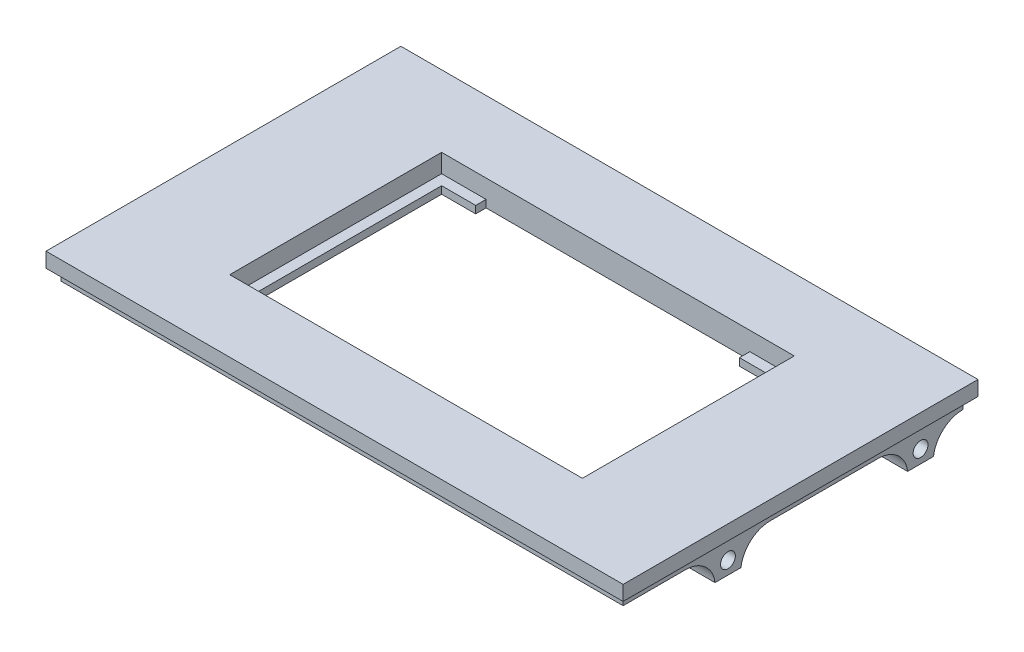
from build123d import *

# Parameters (mm, degrees)
SKETCH_1_W             = 77.9
SKETCH_1_H             = 47.9
EXTRUDE_1_DEPTH        = 2
SKETCH_2_W             = 47.6
SKETCH_2_H             = 28.6
CUT_EXTRUDE_1_DEPTH    = 27
SKETCH_4_W             = 75.9
SKETCH_4_H             = 45.9
SKETCH_4_W_2           = 47.6
SKETCH_4_H_2           = 28.6
EXTRUDE_3_DEPTH        = 0.5
SKETCH_5_W             = 75.9
SKETCH_5_H             = 45.9
SKETCH_5_W_2           = 47.6
SKETCH_5_H_2           = 28.6
EXTRUDE_4_DEPTH        = 1
SKETCH_8_W             = 3.5
SKETCH_8_H             = 3.5
SKETCH_8_R             = 1
EXTRUDE_5_DEPTH        = 4
FILLET_1_R             = 4
FILLET_1_OF_MIRROR_1_R = 4


with BuildPart() as part:
    # 草图1 → 凸台-拉伸1 (new body)
    with BuildSketch(Plane(origin=(0, 0, 0), x_dir=(1, 0, 0), z_dir=(0, 1, 0))):
        with Locations((38.95, 23.95)):
            Rectangle(SKETCH_1_W, SKETCH_1_H)
    extrude(amount=EXTRUDE_1_DEPTH)

    # 草图2 → 切除-拉伸1 (cut)
    with BuildSketch(Plane(origin=(0, 2, 0), x_dir=(1, 0, 0), z_dir=(0, 1, 0))):
        with Locations((38.95, 23.95)):
            Rectangle(SKETCH_2_W, SKETCH_2_H)
    extrude(amount=-CUT_EXTRUDE_1_DEPTH, mode=Mode.SUBTRACT)

    # 草图4 → 凸台-拉伸3 (add)
    with BuildSketch(Plane.XZ):
        with Locations((38.95, -23.95)):
            Rectangle(SKETCH_4_W, SKETCH_4_H)
        with Locations((38.95, -23.95)):
            Rectangle(SKETCH_4_W_2, SKETCH_4_H_2, mode=Mode.SUBTRACT)
    extrude(amount=EXTRUDE_3_DEPTH)

    # 草图5 → 凸台-拉伸4 (add)
    # profile 1 of 3: a face of its own
    with BuildSketch(Plane.XZ.offset(0.5)):
        with Locations((38.95, -23.95)):
            Rectangle(SKETCH_5_W, SKETCH_5_H)
        with Locations((38.95, -23.95)):
            Rectangle(SKETCH_5_W_2, SKETCH_5_H_2, mode=Mode.SUBTRACT)
    # profile 2 of 3: a face of its own
    with BuildSketch(Plane.XZ.offset(0.5)):
        Polygon((15.15, -38.25), (21.15, -38.25), (21.15, -36.85), (16.55, -36.85), (16.55, -11.05), (21.15, -11.05), (21.15, -9.65), (15.15, -9.65), align=None)
    # profile 3 of 3: a face of its own
    with BuildSketch(Plane.XZ.offset(0.5)):
        Polygon((61.35, -11.05), (61.35, -36.85), (56.75, -36.85), (56.75, -38.25), (62.75, -38.25), (62.75, -9.65), (56.75, -9.65), (56.75, -11.05), align=None)
    extrude(amount=EXTRUDE_4_DEPTH)

    # 草图8 → 凸台-拉伸5 (add)
    # profile 1 of 2: a face of its own
    with BuildSketch(Plane(origin=(76.9, 0, 0), x_dir=(0, 0, -1), z_dir=(1, 0, 0))):
        with Locations((41.15, -3.25)):
            Rectangle(SKETCH_8_W, SKETCH_8_H)
        with Locations((41.15, -3.25)):
            Circle(SKETCH_8_R, mode=Mode.SUBTRACT)
    # profile 2 of 2: a face of its own
    with BuildSketch(Plane(origin=(76.9, 0, 0), x_dir=(0, 0, -1), z_dir=(1, 0, 0))):
        with Locations((15.15, -3.25)):
            Rectangle(SKETCH_8_W, SKETCH_8_H)
        with Locations((15.15, -3.25)):
            Circle(SKETCH_8_R, mode=Mode.SUBTRACT)
    extrude_5 = extrude(amount=-EXTRUDE_5_DEPTH)

    # 圆角1
    # the kernel refuses this fillet: 4 mm, written as the material it adds along each edge
    with BuildSketch(Plane(origin=(76.9, -1.5, -42.9), x_dir=(0, 0, -1), z_dir=(-1, 0, 0)), Plane(origin=(76.9, -1.5, -16.9), x_dir=(0, 0, -1), z_dir=(-1, 0, 0))) as fillet_1_piece_1:
        with BuildLine():
            CenterArc((3.968626967, 4), FILLET_1_R, 187.180755781, 82.819244219)
            Line((0, 3.5), (-0.079372539, 3.49))
            ThreePointArc((-0.079372539, 3.49), (-0.08, 1.75), (-0.08, 0))
            Line((-0.08, 0), (0, -0.08))
            Line((0, -0.08), (3.968626967, -0.08))
            Line((3.968626967, -0.08), (3.968626967, 0))
        make_face()
    extrude(amount=4)
    with BuildSketch(Plane(origin=(76.9, -1.5, -13.4), x_dir=(0, 0, 1), z_dir=(-1, 0, 0)), Plane(origin=(76.9, -1.5, -39.4), x_dir=(0, 0, 1), z_dir=(-1, 0, 0))) as fillet_1_piece_2:
        with BuildLine():
            CenterArc((3.968626967, -4), FILLET_1_R, 90, 82.819244219)
            Line((0, -3.5), (-0.079372539, -3.49))
            ThreePointArc((-0.079372539, -3.49), (-0.08, -1.75), (-0.08, 0))
            Line((-0.08, 0), (0, 0.08))
            Line((0, 0.08), (3.968626967, 0.08))
            Line((3.968626967, 0.08), (3.968626967, 0))
        make_face()
    extrude(amount=4)

    # 镜向1: 凸台-拉伸5 across plane
    add(extrude_5.mirror(Plane(origin=(38.95, 0, 0), x_dir=(0, 0, 1), z_dir=(1, 0, 0))))

    # 圆角1 of 镜向1
    # the kernel refuses this fillet: 4 mm, written as the material it adds along each edge
    with BuildSketch(Plane(origin=(1, -1.5, -42.9), x_dir=(0, 0, -1), z_dir=(1, 0, 0)), Plane(origin=(1, -1.5, -16.9), x_dir=(0, 0, -1), z_dir=(1, 0, 0))) as fillet_1_of_mirror_1_piece_1:
        with BuildLine():
            CenterArc((3.968626967, -4), FILLET_1_OF_MIRROR_1_R, 90, 82.819244219)
            Line((0, -3.5), (-0.079372539, -3.49))
            ThreePointArc((-0.079372539, -3.49), (-0.08, -1.75), (-0.08, 0))
            Line((-0.08, 0), (0, 0.08))
            Line((0, 0.08), (3.968626967, 0.08))
            Line((3.968626967, 0.08), (3.968626967, 0))
        make_face()
    extrude(amount=4)
    with BuildSketch(Plane(origin=(1, -1.5, -13.4), x_dir=(0, 0, 1), z_dir=(1, 0, 0)), Plane(origin=(1, -1.5, -39.4), x_dir=(0, 0, 1), z_dir=(1, 0, 0))) as fillet_1_of_mirror_1_piece_2:
        with BuildLine():
            CenterArc((3.968626967, 4), FILLET_1_OF_MIRROR_1_R, 187.180755781, 82.819244219)
            Line((0, 3.5), (-0.079372539, 3.49))
            ThreePointArc((-0.079372539, 3.49), (-0.08, 1.75), (-0.08, 0))
            Line((-0.08, 0), (0, -0.08))
            Line((0, -0.08), (3.968626967, -0.08))
            Line((3.968626967, -0.08), (3.968626967, 0))
        make_face()
    extrude(amount=4)


solid = part.part
